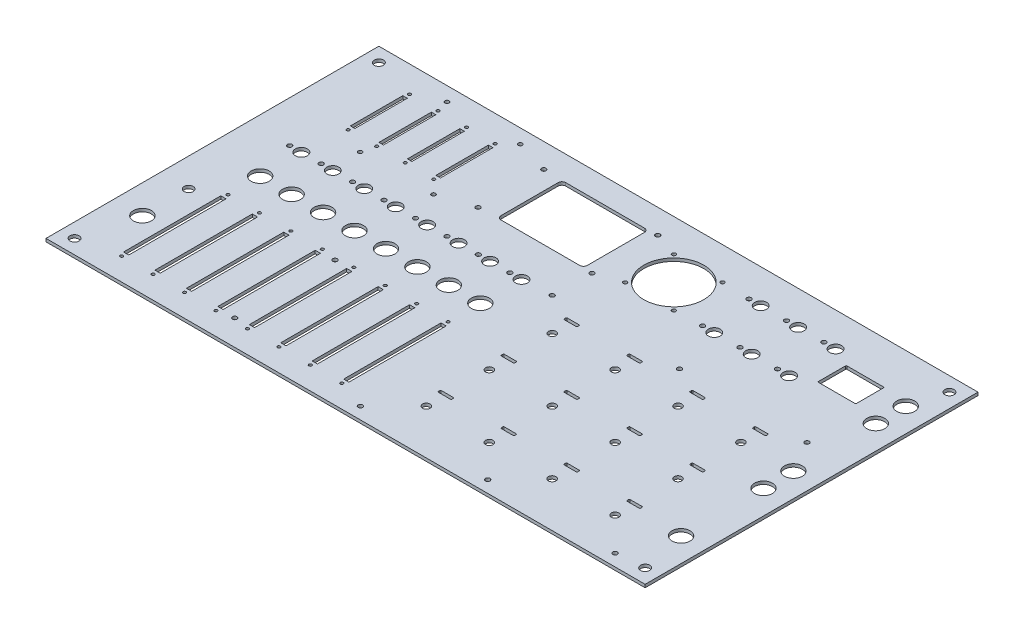
from build123d import *

# Parameters (mm, degrees)
SKETCH1_W                 = 400.05
SKETCH1_H                 = 222.25
BOSS_EXTRUDE1_DEPTH       = 2.03
CUT_EXTRUDE1_REACH        = 485.542
SKETCH2_R                 = 20
SKETCH2_R_2               = 1.25
SKETCH2_R_3               = 1.5
CUT_EXTRUDE2_REACH        = 485.542
SKETCH3_R                 = 6
CUT_EXTRUDE3_REACH        = 485.542
SKETCH4_R                 = 2.5
LPATTERN1_COUNT           = 4
LPATTERN1_PITCH           = 42
LPATTERN2_COUNT           = 3
LPATTERN2_PITCH           = 42
LPATTERN2_COPY_1_REACH    = 485.542
LPATTERN2_COPY_1_SKETCH_R = 2.5
LPATTERN2_COPY_2_REACH    = 485.542
LPATTERN2_COPY_2_SKETCH_R = 2.5
LPATTERN2_COPY_3_REACH    = 485.542
LPATTERN2_COPY_3_SKETCH_R = 2.5
LPATTERN2_COPY_4_REACH    = 485.542
LPATTERN2_COPY_4_SKETCH_R = 2.5
LPATTERN2_COPY_5_REACH    = 485.542
LPATTERN2_COPY_5_SKETCH_R = 2.5
LPATTERN2_COPY_6_REACH    = 485.542
LPATTERN2_COPY_6_SKETCH_R = 2.5
CUT_EXTRUDE6_REACH        = 485.542
SKETCH5_R                 = 1.5
SKETCH5_R_2               = 4
CUT_EXTRUDE7_REACH        = 485.542
SKETCH6_R                 = 1
SKETCH6_W                 = 3.5
SKETCH6_H                 = 65
LPATTERN3_COUNT           = 8
LPATTERN3_PITCH           = 21
CUT_EXTRUDE8_REACH        = 485.542
SKETCH7_R                 = 1
SKETCH7_W                 = 3
SKETCH7_H                 = 35
LPATTERN4_COUNT           = 4
LPATTERN4_PITCH           = 19.05
CUT_EXTRUDE9_REACH        = 485.542
SKETCH8_R                 = 3.048
CUT_EXTRUDE10_REACH       = 485.542
SKETCH9_R                 = 6
SKETCH9_R_2               = 3
CUT_EXTRUDE11_REACH       = 485.542
SKETCH10_R                = 4
SKETCH10_R_2              = 1.5
LPATTERN5_COUNT           = 8
LPATTERN5_PITCH           = 21
LPATTERN6_COUNT           = 3
LPATTERN6_PITCH           = 25
LPATTERN6_COUNT_DIR2      = 2
LPATTERN6_PITCH_DIR2      = 31
CUT_EXTRUDE12_REACH       = 485.542
SKETCH11_R                = 6
LPATTERN7_COUNT           = 8
LPATTERN7_PITCH           = 21
CUT_EXTRUDE13_REACH       = 485.542
SKETCH12_R                = 1.5
CUT_EXTRUDE14_REACH       = 485.542
SKETCH14_R                = 1.35
CUT_EXTRUDE15_REACH       = 485.542
SKETCH18_R                = 1.5


with BuildPart() as part:
    # Sketch1 → Boss-Extrude1 (new body)
    with BuildSketch(Plane(origin=(0, 0, 0), x_dir=(1, 0, 0), z_dir=(0, 1, 0))):
        with Locations((220.366903024, 127.786951943)):
            Rectangle(SKETCH1_W, SKETCH1_H)
    extrude(amount=BOSS_EXTRUDE1_DEPTH)

    # Sketch2 → Cut-Extrude1 (cut, up to next)
    with BuildSketch(Plane(origin=(0, 2.03, 0), x_dir=(1, 0, 0), z_dir=(0, 1, 0)), mode=Mode.PRIVATE) as cut_extrude1_sk1:
        with Locations((255.391903024, 200.811951943)):
            Circle(SKETCH2_R)
    cut_extrude1_tool1 = extrude(cut_extrude1_sk1.sketch, amount=-CUT_EXTRUDE1_REACH, mode=Mode.PRIVATE) & part.part
    # Sketch2 → Cut-Extrude1 (cut, up to next)
    with BuildSketch(Plane(origin=(0, 2.03, 0), x_dir=(1, 0, 0), z_dir=(0, 1, 0)), mode=Mode.PRIVATE) as cut_extrude1_sk2:
        with Locations((271.641903024, 184.561951943)):
            Circle(SKETCH2_R_2)
    cut_extrude1_tool2 = extrude(cut_extrude1_sk2.sketch, amount=-CUT_EXTRUDE1_REACH, mode=Mode.PRIVATE) & part.part
    # Sketch2 → Cut-Extrude1 (cut, up to next)
    with BuildSketch(Plane(origin=(0, 2.03, 0), x_dir=(1, 0, 0), z_dir=(0, 1, 0)), mode=Mode.PRIVATE) as cut_extrude1_sk3:
        with Locations((222.769903024, 178.786951943)):
            Circle(SKETCH2_R_3)
    cut_extrude1_tool3 = extrude(cut_extrude1_sk3.sketch, amount=-CUT_EXTRUDE1_REACH, mode=Mode.PRIVATE) & part.part
    # Sketch2 → Cut-Extrude1 (cut, up to next)
    with BuildSketch(Plane(origin=(0, 2.03, 0), x_dir=(1, 0, 0), z_dir=(0, 1, 0)), mode=Mode.PRIVATE) as cut_extrude1_sk4:
        with Locations((271.641903024, 217.061951943)):
            Circle(SKETCH2_R_2)
    cut_extrude1_tool4 = extrude(cut_extrude1_sk4.sketch, amount=-CUT_EXTRUDE1_REACH, mode=Mode.PRIVATE) & part.part
    # Sketch2 → Cut-Extrude1 (cut, up to next)
    with BuildSketch(Plane(origin=(0, 2.03, 0), x_dir=(1, 0, 0), z_dir=(0, 1, 0)), mode=Mode.PRIVATE) as cut_extrude1_sk5:
        with Locations((239.141903024, 184.561951943)):
            Circle(SKETCH2_R_2)
    cut_extrude1_tool5 = extrude(cut_extrude1_sk5.sketch, amount=-CUT_EXTRUDE1_REACH, mode=Mode.PRIVATE) & part.part
    # Sketch2 → Cut-Extrude1 (cut, up to next)
    with BuildSketch(Plane(origin=(0, 2.03, 0), x_dir=(1, 0, 0), z_dir=(0, 1, 0)), mode=Mode.PRIVATE) as cut_extrude1_sk6:
        with Locations((239.141903024, 217.061951943)):
            Circle(SKETCH2_R_2)
    cut_extrude1_tool6 = extrude(cut_extrude1_sk6.sketch, amount=-CUT_EXTRUDE1_REACH, mode=Mode.PRIVATE) & part.part
    # Sketch2 → Cut-Extrude1 (cut, up to next)
    with BuildSketch(Plane(origin=(0, 2.03, 0), x_dir=(1, 0, 0), z_dir=(0, 1, 0)), mode=Mode.PRIVATE) as cut_extrude1_sk7:
        with Locations((222.769903024, 222.704951943)):
            Circle(SKETCH2_R_3)
    cut_extrude1_tool7 = extrude(cut_extrude1_sk7.sketch, amount=-CUT_EXTRUDE1_REACH, mode=Mode.PRIVATE) & part.part
    # Sketch2 → Cut-Extrude1 (cut, up to next)
    with BuildSketch(Plane(origin=(0, 2.03, 0), x_dir=(1, 0, 0), z_dir=(0, 1, 0)), mode=Mode.PRIVATE) as cut_extrude1_sk8:
        with Locations((146.681903024, 178.786951943)):
            Circle(SKETCH2_R_3)
    cut_extrude1_tool8 = extrude(cut_extrude1_sk8.sketch, amount=-CUT_EXTRUDE1_REACH, mode=Mode.PRIVATE) & part.part
    # Sketch2 → Cut-Extrude1 (cut, up to next)
    with BuildSketch(Plane(origin=(0, 2.03, 0), x_dir=(1, 0, 0), z_dir=(0, 1, 0)), mode=Mode.PRIVATE) as cut_extrude1_sk9:
        with Locations((146.681903024, 222.704951943)):
            Circle(SKETCH2_R_3)
    cut_extrude1_tool9 = extrude(cut_extrude1_sk9.sketch, amount=-CUT_EXTRUDE1_REACH, mode=Mode.PRIVATE) & part.part
    # Sketch2 → Cut-Extrude1 (cut, up to next)
    with BuildSketch(Plane(origin=(0, 2.03, 0), x_dir=(1, 0, 0), z_dir=(0, 1, 0)), mode=Mode.PRIVATE) as cut_extrude1_sk10:
        with BuildLine():
            Line((361.476902888, 191.286951943), (385.876902888, 191.286951943))
            ThreePointArc((385.876902888, 191.286951943), (386.230456278, 191.433398553), (386.376902888, 191.786951943))
            Line((386.376902888, 191.786951943), (386.376902888, 209.836951943))
            ThreePointArc((386.376902888, 209.836951943), (386.230456278, 210.190505334), (385.876902888, 210.336951943))
            Line((385.876902888, 210.336951943), (361.476902888, 210.336951943))
            ThreePointArc((361.476902888, 210.336951943), (361.123349497, 210.190505334), (360.976902888, 209.836951943))
            Line((360.976902888, 209.836951943), (360.976902888, 191.786951943))
            ThreePointArc((360.976902888, 191.786951943), (361.123349497, 191.433398553), (361.476902888, 191.286951943))
        make_face()
    cut_extrude1_tool10 = extrude(cut_extrude1_sk10.sketch, amount=-CUT_EXTRUDE1_REACH, mode=Mode.PRIVATE) & part.part
    # Sketch2 → Cut-Extrude1 (cut, up to next)
    with BuildSketch(Plane(origin=(0, 2.03, 0), x_dir=(1, 0, 0), z_dir=(0, 1, 0)), mode=Mode.PRIVATE) as cut_extrude1_sk11:
        with BuildLine():
            Line((214.141903024, 222.411951943), (161.621903024, 222.411951943))
            ThreePointArc((161.621903024, 222.411951943), (159.8258518, 221.668003168), (159.081903024, 219.871951943))
            Line((159.081903024, 219.871951943), (159.081903024, 181.751951943))
            ThreePointArc((159.081903024, 181.751951943), (159.8258518, 179.955900719), (161.621903024, 179.211951943))
            Line((161.621903024, 179.211951943), (214.141903024, 179.211951943))
            ThreePointArc((214.141903024, 179.211951943), (215.937954248, 179.955900719), (216.681903024, 181.751951943))
            Line((216.681903024, 181.751951943), (216.681903024, 219.871951943))
            ThreePointArc((216.681903024, 219.871951943), (215.937954248, 221.668003168), (214.141903024, 222.411951943))
        make_face()
    cut_extrude1_tool11 = extrude(cut_extrude1_sk11.sketch, amount=-CUT_EXTRUDE1_REACH, mode=Mode.PRIVATE) & part.part
    add(cut_extrude1_tool1.solids().sort_by_distance((255.391903, 2.03, -200.811952))[0], mode=Mode.SUBTRACT)
    add(cut_extrude1_tool2.solids().sort_by_distance((271.641903, 2.03, -184.561952))[0], mode=Mode.SUBTRACT)
    add(cut_extrude1_tool3.solids().sort_by_distance((222.769903, 2.03, -178.786952))[0], mode=Mode.SUBTRACT)
    add(cut_extrude1_tool4.solids().sort_by_distance((271.641903, 2.03, -217.061952))[0], mode=Mode.SUBTRACT)
    add(cut_extrude1_tool5.solids().sort_by_distance((239.141903, 2.03, -184.561952))[0], mode=Mode.SUBTRACT)
    add(cut_extrude1_tool6.solids().sort_by_distance((239.141903, 2.03, -217.061952))[0], mode=Mode.SUBTRACT)
    add(cut_extrude1_tool7.solids().sort_by_distance((222.769903, 2.03, -222.704952))[0], mode=Mode.SUBTRACT)
    add(cut_extrude1_tool8.solids().sort_by_distance((146.681903, 2.03, -178.786952))[0], mode=Mode.SUBTRACT)
    add(cut_extrude1_tool9.solids().sort_by_distance((146.681903, 2.03, -222.704952))[0], mode=Mode.SUBTRACT)
    add(cut_extrude1_tool10.solids().sort_by_distance((373.676903, 2.03, -200.811952))[0], mode=Mode.SUBTRACT)
    add(cut_extrude1_tool11.solids().sort_by_distance((187.881903, 2.03, -200.811952))[0], mode=Mode.SUBTRACT)

    # Sketch3 → Cut-Extrude2 (cut, up to next)
    with BuildSketch(Plane(origin=(0, 2.03, 0), x_dir=(1, 0, 0), z_dir=(0, 1, 0)), mode=Mode.PRIVATE) as cut_extrude2_sk1:
        with Locations((404.391903024, 56.661951943)):
            Circle(SKETCH3_R)
    cut_extrude2_tool1 = extrude(cut_extrude2_sk1.sketch, amount=-CUT_EXTRUDE2_REACH, mode=Mode.PRIVATE) & part.part
    # Sketch3 → Cut-Extrude2 (cut, up to next)
    with BuildSketch(Plane(origin=(0, 2.03, 0), x_dir=(1, 0, 0), z_dir=(0, 1, 0)), mode=Mode.PRIVATE) as cut_extrude2_sk2:
        with Locations((404.391903024, 111.661951943)):
            Circle(SKETCH3_R)
    cut_extrude2_tool2 = extrude(cut_extrude2_sk2.sketch, amount=-CUT_EXTRUDE2_REACH, mode=Mode.PRIVATE) & part.part
    # Sketch3 → Cut-Extrude2 (cut, up to next)
    with BuildSketch(Plane(origin=(0, 2.03, 0), x_dir=(1, 0, 0), z_dir=(0, 1, 0)), mode=Mode.PRIVATE) as cut_extrude2_sk3:
        with Locations((404.391903024, 131.661951943)):
            Circle(SKETCH3_R)
    cut_extrude2_tool3 = extrude(cut_extrude2_sk3.sketch, amount=-CUT_EXTRUDE2_REACH, mode=Mode.PRIVATE) & part.part
    # Sketch3 → Cut-Extrude2 (cut, up to next)
    with BuildSketch(Plane(origin=(0, 2.03, 0), x_dir=(1, 0, 0), z_dir=(0, 1, 0)), mode=Mode.PRIVATE) as cut_extrude2_sk4:
        with Locations((404.391903024, 186.661951943)):
            Circle(SKETCH3_R)
    cut_extrude2_tool4 = extrude(cut_extrude2_sk4.sketch, amount=-CUT_EXTRUDE2_REACH, mode=Mode.PRIVATE) & part.part
    # Sketch3 → Cut-Extrude2 (cut, up to next)
    with BuildSketch(Plane(origin=(0, 2.03, 0), x_dir=(1, 0, 0), z_dir=(0, 1, 0)), mode=Mode.PRIVATE) as cut_extrude2_sk5:
        with Locations((404.391903024, 206.661951943)):
            Circle(SKETCH3_R)
    cut_extrude2_tool5 = extrude(cut_extrude2_sk5.sketch, amount=-CUT_EXTRUDE2_REACH, mode=Mode.PRIVATE) & part.part
    add(cut_extrude2_tool1.solids().sort_by_distance((404.391903, 2.03, -56.661952))[0], mode=Mode.SUBTRACT)
    add(cut_extrude2_tool2.solids().sort_by_distance((404.391903, 2.03, -111.661952))[0], mode=Mode.SUBTRACT)
    add(cut_extrude2_tool3.solids().sort_by_distance((404.391903, 2.03, -131.661952))[0], mode=Mode.SUBTRACT)
    add(cut_extrude2_tool4.solids().sort_by_distance((404.391903, 2.03, -186.661952))[0], mode=Mode.SUBTRACT)
    add(cut_extrude2_tool5.solids().sort_by_distance((404.391903, 2.03, -206.661952))[0], mode=Mode.SUBTRACT)

    # Sketch4 → Cut-Extrude3 (cut, up to next)
    with BuildSketch(Plane(origin=(0, 2.03, 0), x_dir=(1, 0, 0), z_dir=(0, 1, 0)), mode=Mode.PRIVATE) as cut_extrude3_sk1:
        with Locations((370.341903024, 46.661951943)):
            Circle(SKETCH4_R)
    cut_extrude3_tool1 = extrude(cut_extrude3_sk1.sketch, amount=-CUT_EXTRUDE3_REACH, mode=Mode.PRIVATE) & part.part
    # Sketch4 → Cut-Extrude3 (cut, up to next)
    with BuildSketch(Plane(origin=(0, 2.03, 0), x_dir=(1, 0, 0), z_dir=(0, 1, 0)), mode=Mode.PRIVATE) as cut_extrude3_sk2:
        with BuildLine():
            Line((366.341903024, 58.661951943), (374.341903024, 58.661951943))
            ThreePointArc((374.341903024, 58.661951943), (374.695456415, 58.808398553), (374.841903024, 59.161951943))
            Line((374.841903024, 59.161951943), (374.841903024, 60.161951943))
            ThreePointArc((374.841903024, 60.161951943), (374.695456415, 60.515505334), (374.341903024, 60.661951943))
            Line((374.341903024, 60.661951943), (366.341903024, 60.661951943))
            ThreePointArc((366.341903024, 60.661951943), (365.988349633, 60.515505334), (365.841903024, 60.161951943))
            Line((365.841903024, 60.161951943), (365.841903024, 59.161951943))
            ThreePointArc((365.841903024, 59.161951943), (365.988349633, 58.808398553), (366.341903024, 58.661951943))
        make_face()
    cut_extrude3_tool2 = extrude(cut_extrude3_sk2.sketch, amount=-CUT_EXTRUDE3_REACH, mode=Mode.PRIVATE) & part.part
    cut_extrude3_1 = cut_extrude3_tool1.solids().sort_by_distance((370.341903, 2.03, -46.661952))[0]
    add(cut_extrude3_1, mode=Mode.SUBTRACT)
    cut_extrude3_2 = cut_extrude3_tool2.solids().sort_by_distance((370.341903, 2.03, -59.661952))[0]
    add(cut_extrude3_2, mode=Mode.SUBTRACT)
    cut_extrude3 = cut_extrude3_1 + cut_extrude3_2  # Cut-Extrude3 as one shape, for the pattern or mirror that repeats it

    # LPattern1: Cut-Extrude3 ×4
    with Locations(*[(-i * LPATTERN1_PITCH, 0, 0) for i in range(1, LPATTERN1_COUNT)]):
        add(cut_extrude3, mode=Mode.SUBTRACT)

    # LPattern2: Cut-Extrude3 ×3
    with Locations(*[(0, 0, -i * LPATTERN2_PITCH) for i in range(1, LPATTERN2_COUNT)]):
        add(cut_extrude3, mode=Mode.SUBTRACT)

    # LPattern2 copy 1 sketch → LPattern2 copy 1 (cut, up to next)
    with BuildSketch(Plane(origin=(-42, 2.03, -42), x_dir=(1, 0, 0), z_dir=(0, 1, 0)), mode=Mode.PRIVATE) as lpattern2_copy_1_sk1:
        with Locations((370.341903024, 46.661951943)):
            Circle(LPATTERN2_COPY_1_SKETCH_R)
    lpattern2_copy_1_tool1 = extrude(lpattern2_copy_1_sk1.sketch, amount=-LPATTERN2_COPY_1_REACH, mode=Mode.PRIVATE) & part.part
    # LPattern2 copy 1 sketch → LPattern2 copy 1 (cut, up to next)
    with BuildSketch(Plane(origin=(-42, 2.03, -42), x_dir=(1, 0, 0), z_dir=(0, 1, 0)), mode=Mode.PRIVATE) as lpattern2_copy_1_sk2:
        with BuildLine():
            Line((366.341903024, 58.661951943), (374.341903024, 58.661951943))
            ThreePointArc((374.341903024, 58.661951943), (374.695456415, 58.808398553), (374.841903024, 59.161951943))
            Line((374.841903024, 59.161951943), (374.841903024, 60.161951943))
            ThreePointArc((374.841903024, 60.161951943), (374.695456415, 60.515505334), (374.341903024, 60.661951943))
            Line((374.341903024, 60.661951943), (366.341903024, 60.661951943))
            ThreePointArc((366.341903024, 60.661951943), (365.988349633, 60.515505334), (365.841903024, 60.161951943))
            Line((365.841903024, 60.161951943), (365.841903024, 59.161951943))
            ThreePointArc((365.841903024, 59.161951943), (365.988349633, 58.808398553), (366.341903024, 58.661951943))
        make_face()
    lpattern2_copy_1_tool2 = extrude(lpattern2_copy_1_sk2.sketch, amount=-LPATTERN2_COPY_1_REACH, mode=Mode.PRIVATE) & part.part
    add(lpattern2_copy_1_tool1.solids().sort_by_distance((328.341903, 2.03, -88.661952))[0], mode=Mode.SUBTRACT)
    add(lpattern2_copy_1_tool2.solids().sort_by_distance((328.341903, 2.03, -101.661952))[0], mode=Mode.SUBTRACT)

    # LPattern2 copy 2 sketch → LPattern2 copy 2 (cut, up to next)
    with BuildSketch(Plane(origin=(-42, 2.03, -84), x_dir=(1, 0, 0), z_dir=(0, 1, 0)), mode=Mode.PRIVATE) as lpattern2_copy_2_sk1:
        with Locations((370.341903024, 46.661951943)):
            Circle(LPATTERN2_COPY_2_SKETCH_R)
    lpattern2_copy_2_tool1 = extrude(lpattern2_copy_2_sk1.sketch, amount=-LPATTERN2_COPY_2_REACH, mode=Mode.PRIVATE) & part.part
    # LPattern2 copy 2 sketch → LPattern2 copy 2 (cut, up to next)
    with BuildSketch(Plane(origin=(-42, 2.03, -84), x_dir=(1, 0, 0), z_dir=(0, 1, 0)), mode=Mode.PRIVATE) as lpattern2_copy_2_sk2:
        with BuildLine():
            Line((366.341903024, 58.661951943), (374.341903024, 58.661951943))
            ThreePointArc((374.341903024, 58.661951943), (374.695456415, 58.808398553), (374.841903024, 59.161951943))
            Line((374.841903024, 59.161951943), (374.841903024, 60.161951943))
            ThreePointArc((374.841903024, 60.161951943), (374.695456415, 60.515505334), (374.341903024, 60.661951943))
            Line((374.341903024, 60.661951943), (366.341903024, 60.661951943))
            ThreePointArc((366.341903024, 60.661951943), (365.988349633, 60.515505334), (365.841903024, 60.161951943))
            Line((365.841903024, 60.161951943), (365.841903024, 59.161951943))
            ThreePointArc((365.841903024, 59.161951943), (365.988349633, 58.808398553), (366.341903024, 58.661951943))
        make_face()
    lpattern2_copy_2_tool2 = extrude(lpattern2_copy_2_sk2.sketch, amount=-LPATTERN2_COPY_2_REACH, mode=Mode.PRIVATE) & part.part
    add(lpattern2_copy_2_tool1.solids().sort_by_distance((328.341903, 2.03, -130.661952))[0], mode=Mode.SUBTRACT)
    add(lpattern2_copy_2_tool2.solids().sort_by_distance((328.341903, 2.03, -143.661952))[0], mode=Mode.SUBTRACT)

    # LPattern2 copy 3 sketch → LPattern2 copy 3 (cut, up to next)
    with BuildSketch(Plane(origin=(-84, 2.03, -42), x_dir=(1, 0, 0), z_dir=(0, 1, 0)), mode=Mode.PRIVATE) as lpattern2_copy_3_sk1:
        with Locations((370.341903024, 46.661951943)):
            Circle(LPATTERN2_COPY_3_SKETCH_R)
    lpattern2_copy_3_tool1 = extrude(lpattern2_copy_3_sk1.sketch, amount=-LPATTERN2_COPY_3_REACH, mode=Mode.PRIVATE) & part.part
    # LPattern2 copy 3 sketch → LPattern2 copy 3 (cut, up to next)
    with BuildSketch(Plane(origin=(-84, 2.03, -42), x_dir=(1, 0, 0), z_dir=(0, 1, 0)), mode=Mode.PRIVATE) as lpattern2_copy_3_sk2:
        with BuildLine():
            Line((366.341903024, 58.661951943), (374.341903024, 58.661951943))
            ThreePointArc((374.341903024, 58.661951943), (374.695456415, 58.808398553), (374.841903024, 59.161951943))
            Line((374.841903024, 59.161951943), (374.841903024, 60.161951943))
            ThreePointArc((374.841903024, 60.161951943), (374.695456415, 60.515505334), (374.341903024, 60.661951943))
            Line((374.341903024, 60.661951943), (366.341903024, 60.661951943))
            ThreePointArc((366.341903024, 60.661951943), (365.988349633, 60.515505334), (365.841903024, 60.161951943))
            Line((365.841903024, 60.161951943), (365.841903024, 59.161951943))
            ThreePointArc((365.841903024, 59.161951943), (365.988349633, 58.808398553), (366.341903024, 58.661951943))
        make_face()
    lpattern2_copy_3_tool2 = extrude(lpattern2_copy_3_sk2.sketch, amount=-LPATTERN2_COPY_3_REACH, mode=Mode.PRIVATE) & part.part
    add(lpattern2_copy_3_tool1.solids().sort_by_distance((286.341903, 2.03, -88.661952))[0], mode=Mode.SUBTRACT)
    add(lpattern2_copy_3_tool2.solids().sort_by_distance((286.341903, 2.03, -101.661952))[0], mode=Mode.SUBTRACT)

    # LPattern2 copy 4 sketch → LPattern2 copy 4 (cut, up to next)
    with BuildSketch(Plane(origin=(-84, 2.03, -84), x_dir=(1, 0, 0), z_dir=(0, 1, 0)), mode=Mode.PRIVATE) as lpattern2_copy_4_sk1:
        with Locations((370.341903024, 46.661951943)):
            Circle(LPATTERN2_COPY_4_SKETCH_R)
    lpattern2_copy_4_tool1 = extrude(lpattern2_copy_4_sk1.sketch, amount=-LPATTERN2_COPY_4_REACH, mode=Mode.PRIVATE) & part.part
    # LPattern2 copy 4 sketch → LPattern2 copy 4 (cut, up to next)
    with BuildSketch(Plane(origin=(-84, 2.03, -84), x_dir=(1, 0, 0), z_dir=(0, 1, 0)), mode=Mode.PRIVATE) as lpattern2_copy_4_sk2:
        with BuildLine():
            Line((366.341903024, 58.661951943), (374.341903024, 58.661951943))
            ThreePointArc((374.341903024, 58.661951943), (374.695456415, 58.808398553), (374.841903024, 59.161951943))
            Line((374.841903024, 59.161951943), (374.841903024, 60.161951943))
            ThreePointArc((374.841903024, 60.161951943), (374.695456415, 60.515505334), (374.341903024, 60.661951943))
            Line((374.341903024, 60.661951943), (366.341903024, 60.661951943))
            ThreePointArc((366.341903024, 60.661951943), (365.988349633, 60.515505334), (365.841903024, 60.161951943))
            Line((365.841903024, 60.161951943), (365.841903024, 59.161951943))
            ThreePointArc((365.841903024, 59.161951943), (365.988349633, 58.808398553), (366.341903024, 58.661951943))
        make_face()
    lpattern2_copy_4_tool2 = extrude(lpattern2_copy_4_sk2.sketch, amount=-LPATTERN2_COPY_4_REACH, mode=Mode.PRIVATE) & part.part
    add(lpattern2_copy_4_tool1.solids().sort_by_distance((286.341903, 2.03, -130.661952))[0], mode=Mode.SUBTRACT)
    add(lpattern2_copy_4_tool2.solids().sort_by_distance((286.341903, 2.03, -143.661952))[0], mode=Mode.SUBTRACT)

    # LPattern2 copy 5 sketch → LPattern2 copy 5 (cut, up to next)
    with BuildSketch(Plane(origin=(-126, 2.03, -42), x_dir=(1, 0, 0), z_dir=(0, 1, 0)), mode=Mode.PRIVATE) as lpattern2_copy_5_sk1:
        with Locations((370.341903024, 46.661951943)):
            Circle(LPATTERN2_COPY_5_SKETCH_R)
    lpattern2_copy_5_tool1 = extrude(lpattern2_copy_5_sk1.sketch, amount=-LPATTERN2_COPY_5_REACH, mode=Mode.PRIVATE) & part.part
    # LPattern2 copy 5 sketch → LPattern2 copy 5 (cut, up to next)
    with BuildSketch(Plane(origin=(-126, 2.03, -42), x_dir=(1, 0, 0), z_dir=(0, 1, 0)), mode=Mode.PRIVATE) as lpattern2_copy_5_sk2:
        with BuildLine():
            Line((366.341903024, 58.661951943), (374.341903024, 58.661951943))
            ThreePointArc((374.341903024, 58.661951943), (374.695456415, 58.808398553), (374.841903024, 59.161951943))
            Line((374.841903024, 59.161951943), (374.841903024, 60.161951943))
            ThreePointArc((374.841903024, 60.161951943), (374.695456415, 60.515505334), (374.341903024, 60.661951943))
            Line((374.341903024, 60.661951943), (366.341903024, 60.661951943))
            ThreePointArc((366.341903024, 60.661951943), (365.988349633, 60.515505334), (365.841903024, 60.161951943))
            Line((365.841903024, 60.161951943), (365.841903024, 59.161951943))
            ThreePointArc((365.841903024, 59.161951943), (365.988349633, 58.808398553), (366.341903024, 58.661951943))
        make_face()
    lpattern2_copy_5_tool2 = extrude(lpattern2_copy_5_sk2.sketch, amount=-LPATTERN2_COPY_5_REACH, mode=Mode.PRIVATE) & part.part
    add(lpattern2_copy_5_tool1.solids().sort_by_distance((244.341903, 2.03, -88.661952))[0], mode=Mode.SUBTRACT)
    add(lpattern2_copy_5_tool2.solids().sort_by_distance((244.341903, 2.03, -101.661952))[0], mode=Mode.SUBTRACT)

    # LPattern2 copy 6 sketch → LPattern2 copy 6 (cut, up to next)
    with BuildSketch(Plane(origin=(-126, 2.03, -84), x_dir=(1, 0, 0), z_dir=(0, 1, 0)), mode=Mode.PRIVATE) as lpattern2_copy_6_sk1:
        with Locations((370.341903024, 46.661951943)):
            Circle(LPATTERN2_COPY_6_SKETCH_R)
    lpattern2_copy_6_tool1 = extrude(lpattern2_copy_6_sk1.sketch, amount=-LPATTERN2_COPY_6_REACH, mode=Mode.PRIVATE) & part.part
    # LPattern2 copy 6 sketch → LPattern2 copy 6 (cut, up to next)
    with BuildSketch(Plane(origin=(-126, 2.03, -84), x_dir=(1, 0, 0), z_dir=(0, 1, 0)), mode=Mode.PRIVATE) as lpattern2_copy_6_sk2:
        with BuildLine():
            Line((366.341903024, 58.661951943), (374.341903024, 58.661951943))
            ThreePointArc((374.341903024, 58.661951943), (374.695456415, 58.808398553), (374.841903024, 59.161951943))
            Line((374.841903024, 59.161951943), (374.841903024, 60.161951943))
            ThreePointArc((374.841903024, 60.161951943), (374.695456415, 60.515505334), (374.341903024, 60.661951943))
            Line((374.341903024, 60.661951943), (366.341903024, 60.661951943))
            ThreePointArc((366.341903024, 60.661951943), (365.988349633, 60.515505334), (365.841903024, 60.161951943))
            Line((365.841903024, 60.161951943), (365.841903024, 59.161951943))
            ThreePointArc((365.841903024, 59.161951943), (365.988349633, 58.808398553), (366.341903024, 58.661951943))
        make_face()
    lpattern2_copy_6_tool2 = extrude(lpattern2_copy_6_sk2.sketch, amount=-LPATTERN2_COPY_6_REACH, mode=Mode.PRIVATE) & part.part
    add(lpattern2_copy_6_tool1.solids().sort_by_distance((244.341903, 2.03, -130.661952))[0], mode=Mode.SUBTRACT)
    add(lpattern2_copy_6_tool2.solids().sort_by_distance((244.341903, 2.03, -143.661952))[0], mode=Mode.SUBTRACT)

    # Sketch5 → Cut-Extrude6 (cut, up to next)
    with BuildSketch(Plane(origin=(0, 2.03, 0), x_dir=(1, 0, 0), z_dir=(0, 1, 0)), mode=Mode.PRIVATE) as cut_extrude6_sk1:
        with Locations((340.091903024, 185.311951943)):
            Circle(SKETCH5_R)
    cut_extrude6_tool1 = extrude(cut_extrude6_sk1.sketch, amount=-CUT_EXTRUDE6_REACH, mode=Mode.PRIVATE) & part.part
    # Sketch5 → Cut-Extrude6 (cut, up to next)
    with BuildSketch(Plane(origin=(0, 2.03, 0), x_dir=(1, 0, 0), z_dir=(0, 1, 0)), mode=Mode.PRIVATE) as cut_extrude6_sk2:
        with Locations((347.891903024, 185.311951943)):
            Circle(SKETCH5_R_2)
    cut_extrude6_tool2 = extrude(cut_extrude6_sk2.sketch, amount=-CUT_EXTRUDE6_REACH, mode=Mode.PRIVATE) & part.part
    cut_extrude6_1 = cut_extrude6_tool1.solids().sort_by_distance((340.091903, 2.03, -185.311952))[0]
    add(cut_extrude6_1, mode=Mode.SUBTRACT)
    cut_extrude6_2 = cut_extrude6_tool2.solids().sort_by_distance((347.891903, 2.03, -185.311952))[0]
    add(cut_extrude6_2, mode=Mode.SUBTRACT)
    cut_extrude6 = cut_extrude6_1 + cut_extrude6_2  # Cut-Extrude6 as one shape, for the pattern or mirror that repeats it

    # Sketch6 → Cut-Extrude7 (cut, up to next)
    with BuildSketch(Plane(origin=(0, 2.03, 0), x_dir=(1, 0, 0), z_dir=(0, 1, 0)), mode=Mode.PRIVATE) as cut_extrude7_sk1:
        with Locations((202.841903024, 102.661951943)):
            Circle(SKETCH6_R)
    cut_extrude7_tool1 = extrude(cut_extrude7_sk1.sketch, amount=-CUT_EXTRUDE7_REACH, mode=Mode.PRIVATE) & part.part
    # Sketch6 → Cut-Extrude7 (cut, up to next)
    with BuildSketch(Plane(origin=(0, 2.03, 0), x_dir=(1, 0, 0), z_dir=(0, 1, 0)), mode=Mode.PRIVATE) as cut_extrude7_sk2:
        with Locations((202.841903024, 31.661951943)):
            Circle(SKETCH6_R)
    cut_extrude7_tool2 = extrude(cut_extrude7_sk2.sketch, amount=-CUT_EXTRUDE7_REACH, mode=Mode.PRIVATE) & part.part
    # Sketch6 → Cut-Extrude7 (cut, up to next)
    with BuildSketch(Plane(origin=(0, 2.03, 0), x_dir=(1, 0, 0), z_dir=(0, 1, 0)), mode=Mode.PRIVATE) as cut_extrude7_sk3:
        with Locations((202.841903024, 67.161951943)):
            Rectangle(SKETCH6_W, SKETCH6_H)
    cut_extrude7_tool3 = extrude(cut_extrude7_sk3.sketch, amount=-CUT_EXTRUDE7_REACH, mode=Mode.PRIVATE) & part.part
    cut_extrude7_1 = cut_extrude7_tool1.solids().sort_by_distance((202.841903, 2.03, -102.661952))[0]
    add(cut_extrude7_1, mode=Mode.SUBTRACT)
    cut_extrude7_2 = cut_extrude7_tool2.solids().sort_by_distance((202.841903, 2.03, -31.661952))[0]
    add(cut_extrude7_2, mode=Mode.SUBTRACT)
    cut_extrude7_3 = cut_extrude7_tool3.solids().sort_by_distance((202.841903, 2.03, -67.161952))[0]
    add(cut_extrude7_3, mode=Mode.SUBTRACT)
    cut_extrude7 = cut_extrude7_1 + cut_extrude7_2 + cut_extrude7_3  # Cut-Extrude7 as one shape, for the pattern or mirror that repeats it

    # LPattern3: Cut-Extrude7 ×8
    with Locations(*[(-i * LPATTERN3_PITCH, 0, 0) for i in range(1, LPATTERN3_COUNT)]):
        add(cut_extrude7, mode=Mode.SUBTRACT)

    # Sketch7 → Cut-Extrude8 (cut, up to next)
    with BuildSketch(Plane(origin=(0, 2.03, 0), x_dir=(1, 0, 0), z_dir=(0, 1, 0)), mode=Mode.PRIVATE) as cut_extrude8_sk1:
        with Locations((115.591903024, 180.311951943)):
            Circle(SKETCH7_R)
    cut_extrude8_tool1 = extrude(cut_extrude8_sk1.sketch, amount=-CUT_EXTRUDE8_REACH, mode=Mode.PRIVATE) & part.part
    # Sketch7 → Cut-Extrude8 (cut, up to next)
    with BuildSketch(Plane(origin=(0, 2.03, 0), x_dir=(1, 0, 0), z_dir=(0, 1, 0)), mode=Mode.PRIVATE) as cut_extrude8_sk2:
        with Locations((115.591903024, 221.311951943)):
            Circle(SKETCH7_R)
    cut_extrude8_tool2 = extrude(cut_extrude8_sk2.sketch, amount=-CUT_EXTRUDE8_REACH, mode=Mode.PRIVATE) & part.part
    # Sketch7 → Cut-Extrude8 (cut, up to next)
    with BuildSketch(Plane(origin=(0, 2.03, 0), x_dir=(1, 0, 0), z_dir=(0, 1, 0)), mode=Mode.PRIVATE) as cut_extrude8_sk3:
        with Locations((115.591903024, 200.811951943)):
            Rectangle(SKETCH7_W, SKETCH7_H)
    cut_extrude8_tool3 = extrude(cut_extrude8_sk3.sketch, amount=-CUT_EXTRUDE8_REACH, mode=Mode.PRIVATE) & part.part
    cut_extrude8_1 = cut_extrude8_tool1.solids().sort_by_distance((115.591903, 2.03, -180.311952))[0]
    add(cut_extrude8_1, mode=Mode.SUBTRACT)
    cut_extrude8_2 = cut_extrude8_tool2.solids().sort_by_distance((115.591903, 2.03, -221.311952))[0]
    add(cut_extrude8_2, mode=Mode.SUBTRACT)
    cut_extrude8_3 = cut_extrude8_tool3.solids().sort_by_distance((115.591903, 2.03, -200.811952))[0]
    add(cut_extrude8_3, mode=Mode.SUBTRACT)
    cut_extrude8 = cut_extrude8_1 + cut_extrude8_2 + cut_extrude8_3  # Cut-Extrude8 as one shape, for the pattern or mirror that repeats it

    # LPattern4: Cut-Extrude8 ×4
    with Locations(*[(-i * LPATTERN4_PITCH, 0, 0) for i in range(1, LPATTERN4_COUNT)]):
        add(cut_extrude8, mode=Mode.SUBTRACT)

    # Sketch8 → Cut-Extrude9 (cut, up to next)
    with BuildSketch(Plane(origin=(0, 2.03, 0), x_dir=(1, 0, 0), z_dir=(0, 1, 0)), mode=Mode.PRIVATE) as cut_extrude9_sk1:
        with Locations((410.866903024, 26.186951943)):
            Circle(SKETCH8_R)
    cut_extrude9_tool1 = extrude(cut_extrude9_sk1.sketch, amount=-CUT_EXTRUDE9_REACH, mode=Mode.PRIVATE) & part.part
    # Sketch8 → Cut-Extrude9 (cut, up to next)
    with BuildSketch(Plane(origin=(0, 2.03, 0), x_dir=(1, 0, 0), z_dir=(0, 1, 0)), mode=Mode.PRIVATE) as cut_extrude9_sk2:
        with Locations((410.866903024, 229.386951943)):
            Circle(SKETCH8_R)
    cut_extrude9_tool2 = extrude(cut_extrude9_sk2.sketch, amount=-CUT_EXTRUDE9_REACH, mode=Mode.PRIVATE) & part.part
    # Sketch8 → Cut-Extrude9 (cut, up to next)
    with BuildSketch(Plane(origin=(0, 2.03, 0), x_dir=(1, 0, 0), z_dir=(0, 1, 0)), mode=Mode.PRIVATE) as cut_extrude9_sk3:
        with Locations((29.866903024, 26.186951943)):
            Circle(SKETCH8_R)
    cut_extrude9_tool3 = extrude(cut_extrude9_sk3.sketch, amount=-CUT_EXTRUDE9_REACH, mode=Mode.PRIVATE) & part.part
    # Sketch8 → Cut-Extrude9 (cut, up to next)
    with BuildSketch(Plane(origin=(0, 2.03, 0), x_dir=(1, 0, 0), z_dir=(0, 1, 0)), mode=Mode.PRIVATE) as cut_extrude9_sk4:
        with Locations((29.866903024, 229.386951943)):
            Circle(SKETCH8_R)
    cut_extrude9_tool4 = extrude(cut_extrude9_sk4.sketch, amount=-CUT_EXTRUDE9_REACH, mode=Mode.PRIVATE) & part.part
    add(cut_extrude9_tool1.solids().sort_by_distance((410.866903, 2.03, -26.186952))[0], mode=Mode.SUBTRACT)
    add(cut_extrude9_tool2.solids().sort_by_distance((410.866903, 2.03, -229.386952))[0], mode=Mode.SUBTRACT)
    add(cut_extrude9_tool3.solids().sort_by_distance((29.866903, 2.03, -26.186952))[0], mode=Mode.SUBTRACT)
    add(cut_extrude9_tool4.solids().sort_by_distance((29.866903, 2.03, -229.386952))[0], mode=Mode.SUBTRACT)

    # Sketch9 → Cut-Extrude10 (cut, up to next)
    with BuildSketch(Plane(origin=(0, 2.03, 0), x_dir=(1, 0, 0), z_dir=(0, 1, 0)), mode=Mode.PRIVATE) as cut_extrude10_sk1:
        with Locations((39.391903024, 61.954951943)):
            Circle(SKETCH9_R)
    cut_extrude10_tool1 = extrude(cut_extrude10_sk1.sketch, amount=-CUT_EXTRUDE10_REACH, mode=Mode.PRIVATE) & part.part
    # Sketch9 → Cut-Extrude10 (cut, up to next)
    with BuildSketch(Plane(origin=(0, 2.03, 0), x_dir=(1, 0, 0), z_dir=(0, 1, 0)), mode=Mode.PRIVATE) as cut_extrude10_sk2:
        with Locations((39.391903024, 92.861951943)):
            Circle(SKETCH9_R_2)
    cut_extrude10_tool2 = extrude(cut_extrude10_sk2.sketch, amount=-CUT_EXTRUDE10_REACH, mode=Mode.PRIVATE) & part.part
    add(cut_extrude10_tool1.solids().sort_by_distance((39.391903, 2.03, -61.954952))[0], mode=Mode.SUBTRACT)
    add(cut_extrude10_tool2.solids().sort_by_distance((39.391903, 2.03, -92.861952))[0], mode=Mode.SUBTRACT)

    # Sketch10 → Cut-Extrude11 (cut, up to next)
    with BuildSketch(Plane(origin=(0, 2.03, 0), x_dir=(1, 0, 0), z_dir=(0, 1, 0)), mode=Mode.PRIVATE) as cut_extrude11_sk1:
        with Locations((202.841903024, 151.661951943)):
            Circle(SKETCH10_R)
    cut_extrude11_tool1 = extrude(cut_extrude11_sk1.sketch, amount=-CUT_EXTRUDE11_REACH, mode=Mode.PRIVATE) & part.part
    # Sketch10 → Cut-Extrude11 (cut, up to next)
    with BuildSketch(Plane(origin=(0, 2.03, 0), x_dir=(1, 0, 0), z_dir=(0, 1, 0)), mode=Mode.PRIVATE) as cut_extrude11_sk2:
        with Locations((195.041903024, 151.661951943)):
            Circle(SKETCH10_R_2)
    cut_extrude11_tool2 = extrude(cut_extrude11_sk2.sketch, amount=-CUT_EXTRUDE11_REACH, mode=Mode.PRIVATE) & part.part
    cut_extrude11_1 = cut_extrude11_tool1.solids().sort_by_distance((202.841903, 2.03, -151.661952))[0]
    add(cut_extrude11_1, mode=Mode.SUBTRACT)
    cut_extrude11_2 = cut_extrude11_tool2.solids().sort_by_distance((195.041903, 2.03, -151.661952))[0]
    add(cut_extrude11_2, mode=Mode.SUBTRACT)
    cut_extrude11 = cut_extrude11_1 + cut_extrude11_2  # Cut-Extrude11 as one shape, for the pattern or mirror that repeats it

    # LPattern5: Cut-Extrude11 ×8
    with Locations(*[(-i * LPATTERN5_PITCH, 0, 0) for i in range(1, LPATTERN5_COUNT)]):
        add(cut_extrude11, mode=Mode.SUBTRACT)

    # LPattern6: Cut-Extrude6 3 × 2
    with Locations(*[(-i * LPATTERN6_PITCH, 0, -j * LPATTERN6_PITCH_DIR2) for i in range(LPATTERN6_COUNT) for j in range(LPATTERN6_COUNT_DIR2) if (i, j) != (0, 0)]):
        add(cut_extrude6, mode=Mode.SUBTRACT)

    # Sketch11 → Cut-Extrude12 (cut, up to next)
    with BuildSketch(Plane(origin=(0, 2.03, 0), x_dir=(1, 0, 0), z_dir=(0, 1, 0)), mode=Mode.PRIVATE) as cut_extrude12_sk1:
        with Locations((202.841903024, 124.161951943)):
            Circle(SKETCH11_R)
    cut_extrude12_tool1 = extrude(cut_extrude12_sk1.sketch, amount=-CUT_EXTRUDE12_REACH, mode=Mode.PRIVATE) & part.part
    cut_extrude12 = cut_extrude12_tool1.solids().sort_by_distance((202.841903, 2.03, -124.161952))[0]
    add(cut_extrude12, mode=Mode.SUBTRACT)

    # LPattern7: Cut-Extrude12 ×8
    with Locations(*[(-i * LPATTERN7_PITCH, 0, 0) for i in range(1, LPATTERN7_COUNT)]):
        add(cut_extrude12, mode=Mode.SUBTRACT)

    # Sketch12 → Cut-Extrude13 (cut, up to next)
    with BuildSketch(Plane(origin=(0, 2.03, 0), x_dir=(1, 0, 0), z_dir=(0, 1, 0)), mode=Mode.PRIVATE) as cut_extrude13_sk1:
        with Locations((392.391903024, 24.611951943)):
            Circle(SKETCH12_R)
    cut_extrude13_tool1 = extrude(cut_extrude13_sk1.sketch, amount=-CUT_EXTRUDE13_REACH, mode=Mode.PRIVATE) & part.part
    # Sketch12 → Cut-Extrude13 (cut, up to next)
    with BuildSketch(Plane(origin=(0, 2.03, 0), x_dir=(1, 0, 0), z_dir=(0, 1, 0)), mode=Mode.PRIVATE) as cut_extrude13_sk2:
        with Locations((392.391903024, 152.691951943)):
            Circle(SKETCH12_R)
    cut_extrude13_tool2 = extrude(cut_extrude13_sk2.sketch, amount=-CUT_EXTRUDE13_REACH, mode=Mode.PRIVATE) & part.part
    # Sketch12 → Cut-Extrude13 (cut, up to next)
    with BuildSketch(Plane(origin=(0, 2.03, 0), x_dir=(1, 0, 0), z_dir=(0, 1, 0)), mode=Mode.PRIVATE) as cut_extrude13_sk3:
        with Locations((222.291903024, 24.611951943)):
            Circle(SKETCH12_R)
    cut_extrude13_tool3 = extrude(cut_extrude13_sk3.sketch, amount=-CUT_EXTRUDE13_REACH, mode=Mode.PRIVATE) & part.part
    # Sketch12 → Cut-Extrude13 (cut, up to next)
    with BuildSketch(Plane(origin=(0, 2.03, 0), x_dir=(1, 0, 0), z_dir=(0, 1, 0)), mode=Mode.PRIVATE) as cut_extrude13_sk4:
        with Locations((222.291903024, 152.691951943)):
            Circle(SKETCH12_R)
    cut_extrude13_tool4 = extrude(cut_extrude13_sk4.sketch, amount=-CUT_EXTRUDE13_REACH, mode=Mode.PRIVATE) & part.part
    # Sketch12 → Cut-Extrude13 (cut, up to next)
    with BuildSketch(Plane(origin=(0, 2.03, 0), x_dir=(1, 0, 0), z_dir=(0, 1, 0)), mode=Mode.PRIVATE) as cut_extrude13_sk5:
        with Locations((307.341903024, 24.611951943)):
            Circle(SKETCH12_R)
    cut_extrude13_tool5 = extrude(cut_extrude13_sk5.sketch, amount=-CUT_EXTRUDE13_REACH, mode=Mode.PRIVATE) & part.part
    # Sketch12 → Cut-Extrude13 (cut, up to next)
    with BuildSketch(Plane(origin=(0, 2.03, 0), x_dir=(1, 0, 0), z_dir=(0, 1, 0)), mode=Mode.PRIVATE) as cut_extrude13_sk6:
        with Locations((307.341903024, 152.691951943)):
            Circle(SKETCH12_R)
    cut_extrude13_tool6 = extrude(cut_extrude13_sk6.sketch, amount=-CUT_EXTRUDE13_REACH, mode=Mode.PRIVATE) & part.part
    add(cut_extrude13_tool1.solids().sort_by_distance((392.391903, 2.03, -24.611952))[0], mode=Mode.SUBTRACT)
    add(cut_extrude13_tool2.solids().sort_by_distance((392.391903, 2.03, -152.691952))[0], mode=Mode.SUBTRACT)
    add(cut_extrude13_tool3.solids().sort_by_distance((222.291903, 2.03, -24.611952))[0], mode=Mode.SUBTRACT)
    add(cut_extrude13_tool4.solids().sort_by_distance((222.291903, 2.03, -152.691952))[0], mode=Mode.SUBTRACT)
    add(cut_extrude13_tool5.solids().sort_by_distance((307.341903, 2.03, -24.611952))[0], mode=Mode.SUBTRACT)
    add(cut_extrude13_tool6.solids().sort_by_distance((307.341903, 2.03, -152.691952))[0], mode=Mode.SUBTRACT)

    # Sketch14 → Cut-Extrude14 (cut, up to next)
    with BuildSketch(Plane(origin=(0, 2.03, 0), x_dir=(1, 0, 0), z_dir=(0, 1, 0)), mode=Mode.PRIVATE) as cut_extrude14_sk1:
        with Locations((124.266903024, 229.481951943)):
            Circle(SKETCH14_R)
    cut_extrude14_tool1 = extrude(cut_extrude14_sk1.sketch, amount=-CUT_EXTRUDE14_REACH, mode=Mode.PRIVATE) & part.part
    # Sketch14 → Cut-Extrude14 (cut, up to next)
    with BuildSketch(Plane(origin=(0, 2.03, 0), x_dir=(1, 0, 0), z_dir=(0, 1, 0)), mode=Mode.PRIVATE) as cut_extrude14_sk2:
        with Locations((75.266903024, 229.481951943)):
            Circle(SKETCH14_R)
    cut_extrude14_tool2 = extrude(cut_extrude14_sk2.sketch, amount=-CUT_EXTRUDE14_REACH, mode=Mode.PRIVATE) & part.part
    # Sketch14 → Cut-Extrude14 (cut, up to next)
    with BuildSketch(Plane(origin=(0, 2.03, 0), x_dir=(1, 0, 0), z_dir=(0, 1, 0)), mode=Mode.PRIVATE) as cut_extrude14_sk3:
        with Locations((75.266903024, 171.481951943)):
            Circle(SKETCH14_R)
    cut_extrude14_tool3 = extrude(cut_extrude14_sk3.sketch, amount=-CUT_EXTRUDE14_REACH, mode=Mode.PRIVATE) & part.part
    # Sketch14 → Cut-Extrude14 (cut, up to next)
    with BuildSketch(Plane(origin=(0, 2.03, 0), x_dir=(1, 0, 0), z_dir=(0, 1, 0)), mode=Mode.PRIVATE) as cut_extrude14_sk4:
        with Locations((124.266903024, 171.481951943)):
            Circle(SKETCH14_R)
    cut_extrude14_tool4 = extrude(cut_extrude14_sk4.sketch, amount=-CUT_EXTRUDE14_REACH, mode=Mode.PRIVATE) & part.part
    add(cut_extrude14_tool1.solids().sort_by_distance((124.266903, 2.03, -229.481952))[0], mode=Mode.SUBTRACT)
    add(cut_extrude14_tool2.solids().sort_by_distance((75.266903, 2.03, -229.481952))[0], mode=Mode.SUBTRACT)
    add(cut_extrude14_tool3.solids().sort_by_distance((75.266903, 2.03, -171.481952))[0], mode=Mode.SUBTRACT)
    add(cut_extrude14_tool4.solids().sort_by_distance((124.266903, 2.03, -171.481952))[0], mode=Mode.SUBTRACT)

    # Sketch18 → Cut-Extrude15 (cut, up to next)
    with BuildSketch(Plane(origin=(0, 2.03, 0), x_dir=(1, 0, 0), z_dir=(0, 1, 0)), mode=Mode.PRIVATE) as cut_extrude15_sk1:
        with Locations((129.341903024, 33.661951943)):
            Circle(SKETCH18_R)
    cut_extrude15_tool1 = extrude(cut_extrude15_sk1.sketch, amount=-CUT_EXTRUDE15_REACH, mode=Mode.PRIVATE) & part.part
    # Sketch18 → Cut-Extrude15 (cut, up to next)
    with BuildSketch(Plane(origin=(0, 2.03, 0), x_dir=(1, 0, 0), z_dir=(0, 1, 0)), mode=Mode.PRIVATE) as cut_extrude15_sk2:
        with Locations((129.341903024, 100.661951943)):
            Circle(SKETCH18_R)
    cut_extrude15_tool2 = extrude(cut_extrude15_sk2.sketch, amount=-CUT_EXTRUDE15_REACH, mode=Mode.PRIVATE) & part.part
    add(cut_extrude15_tool1.solids().sort_by_distance((129.341903, 2.03, -33.661952))[0], mode=Mode.SUBTRACT)
    add(cut_extrude15_tool2.solids().sort_by_distance((129.341903, 2.03, -100.661952))[0], mode=Mode.SUBTRACT)


solid = part.part
